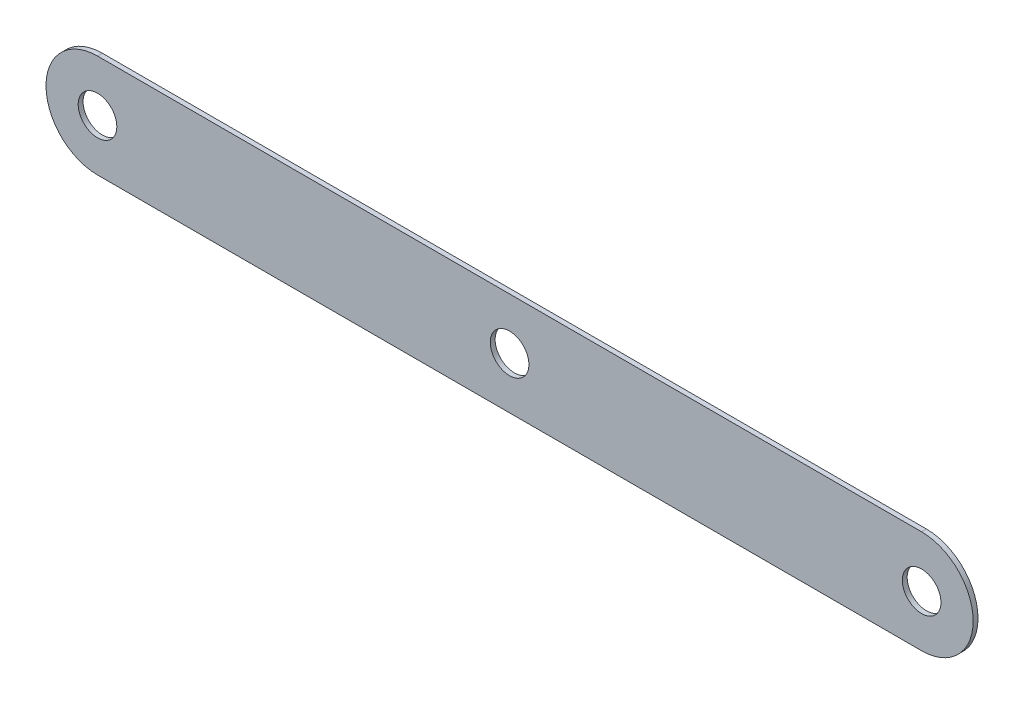
from build123d import *

# Parameters (mm, degrees)
BOSS_EXTRUDE1_DEPTH = 1.2
SKETCH2_R           = 4.7625
CUT_EXTRUDE1_DEPTH  = 116.009651769
SKETCH3_R           = 4.7625
CUT_EXTRUDE2_DEPTH  = 116.009651769


with BuildPart() as part:
    # Sketch1 → Boss-Extrude1 (new body)
    with BuildSketch(Plane.XY):
        with BuildLine():
            Line((101.6, 12.7), (-101.6, 12.7))
            ThreePointArc((-101.6, 12.7), (-114.3, 0), (-101.6, -12.7))
            Line((-101.6, -12.7), (101.6, -12.7))
            ThreePointArc((101.6, -12.7), (114.3, 0), (101.6, 12.7))
        make_face()
    extrude(amount=BOSS_EXTRUDE1_DEPTH)

    # Sketch2 → Cut-Extrude1 (cut, through all)
    with BuildSketch(Plane.XY.offset(1.2)):
        Circle(SKETCH2_R)
    extrude(amount=-CUT_EXTRUDE1_DEPTH, mode=Mode.SUBTRACT)

    # Sketch3 → Cut-Extrude2 (cut, through all)
    with BuildSketch(Plane.XY.offset(1.2)):
        with Locations((-101.6, 0)):
            Circle(SKETCH3_R)
        with Locations((101.6, 0)):
            Circle(SKETCH3_R)
    extrude(amount=-CUT_EXTRUDE2_DEPTH, mode=Mode.SUBTRACT)


solid = part.part
